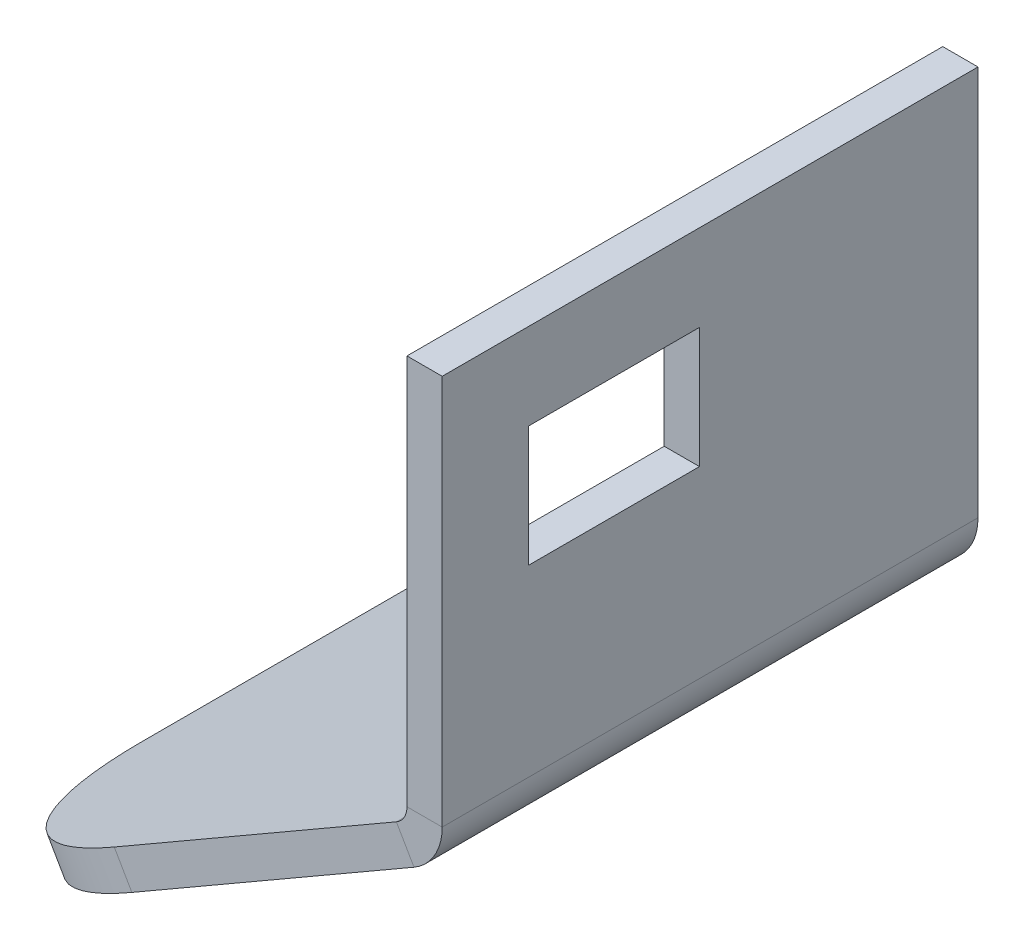
from build123d import *

# Parameters (mm, degrees)
ODGI_CIE_BAZOWE1_DEPTH     = 76
ZAOKR_GLENIE1_R            = 30
WYTNIJ_WYCI_GNI_CIE1_REACH = 120.035
SZKIC2_W                   = 24.223008457
SZKIC2_H                   = 17.102544726


# Sheet-metal steps are written as plain solids
with BuildPart() as part:
    # Szkic1 → Odgięcie bazowe1 (new body)
    with BuildSketch(Plane.XY):
        with BuildLine():
            Line((-70, -40.414518843), (-4, -2.309401077))
            ThreePointArc((-4, -2.309401077), (-1.07179677, 0.618802154), (0, 4.618802154))
            Line((0, 4.618802154), (0, 60))
            Line((0, 60), (-5, 60))
            Line((-5, 60), (-5, 4.618802154))
            ThreePointArc((-5, 4.618802154), (-5.401923789, 3.118802154), (-6.5, 2.020725942))
            Line((-6.5, 2.020725942), (-72.5, -36.084391824))
            Line((-72.5, -36.084391824), (-70, -40.414518843))
        make_face()
    extrude(amount=ODGI_CIE_BAZOWE1_DEPTH)

    # Zaokrąglenie1
    zaokr_glenie1_edges = [part.edges().sort_by_distance(p)[0] for p in [
        (-71.25, -38.249455334, 76),
    ]]
    fillet(zaokr_glenie1_edges, radius=ZAOKR_GLENIE1_R)

    # Szkic2 → Wytnij-wyciągnięcie1 (cut, up to next)
    with BuildSketch(Plane.ZY.offset(5), mode=Mode.PRIVATE) as wytnij_wyci_gni_cie1_sk1:
        with Locations((51.623539351, 39.212758495)):
            Rectangle(SZKIC2_W, SZKIC2_H)
    wytnij_wyci_gni_cie1_tool1 = extrude(wytnij_wyci_gni_cie1_sk1.sketch, amount=-WYTNIJ_WYCI_GNI_CIE1_REACH, mode=Mode.PRIVATE) & part.part
    add(wytnij_wyci_gni_cie1_tool1.solids().sort_by_distance((-5, 39.212758, 51.623539))[0], mode=Mode.SUBTRACT)


solid = part.part
